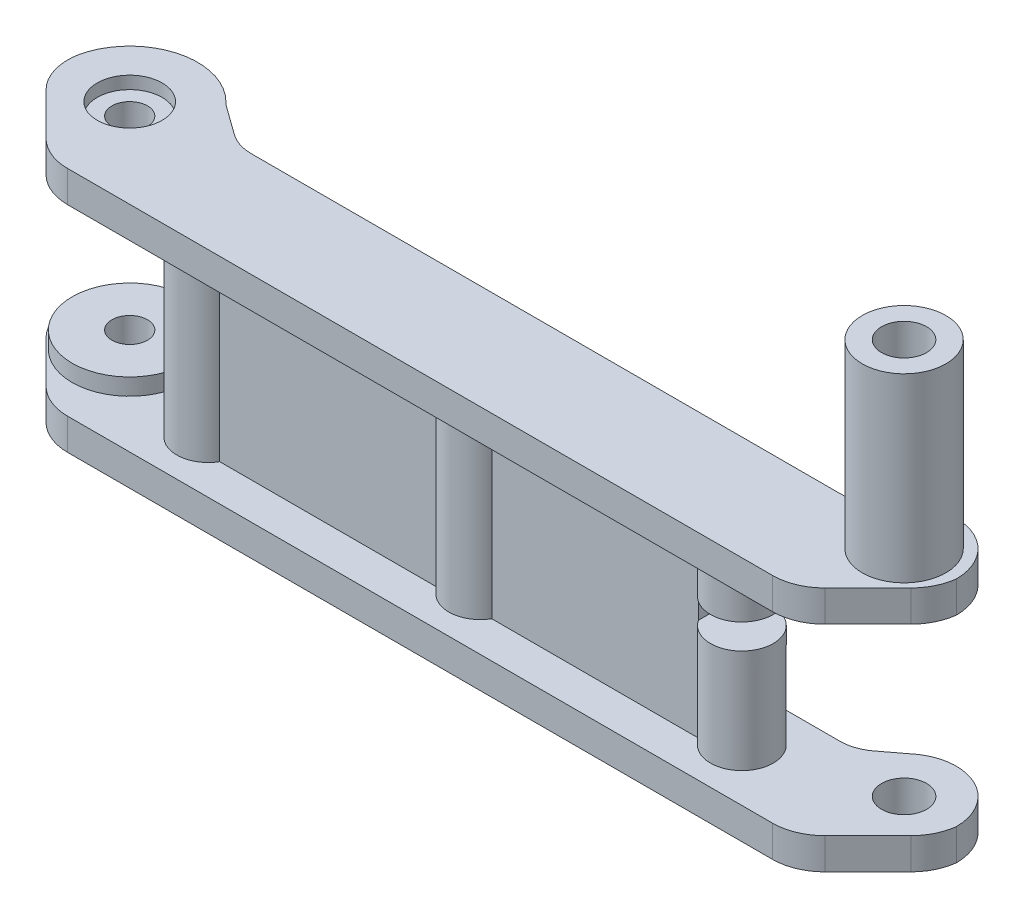
from build123d import *

# Parameters (mm, degrees)
SKETCH_1_R          = 4.5
SKETCH_1_R_2        = 1.6
EXTRUDE_3_DEPTH     = 3
SKETCH_2_R          = 3
EXTRUDE_4_DEPTH     = 17.5
SKETCH_3_R          = 3
SKETCH_3_R_2        = 1.6
EXTRUDE_5_DEPTH     = 3
SKETCH_4_R          = 1.6
SKETCH_4_R_2        = 2.15
CUT_EXTRUDE_1_DEPTH = 100
SKETCH_6_R          = 4
SKETCH_6_R_2        = 2.15
EXTRUDE_6_DEPTH     = 17.3
SKETCH_7_R          = 2.15
SKETCH_7_R_2        = 1.6
EXTRUDE_7_DEPTH     = 3
EXTRUDE_START       = -3
SKETCH_8_R          = 1.6
EXTRUDE_8_DEPTH     = 3
EXTRUDE_10_DEPTH    = 17.5
CUT_EXTRUDE_START   = -100
CUT_EXTRUDE_2_DEPTH = 100
SKETCH_13_R         = 2.15
CUT_EXTRUDE_3_DEPTH = 23.5
CHAMFER_1_SIZE      = 7
FILLET_1_R          = 5
SKETCH_14_W         = 6
SKETCH_14_H         = 2.4
CUT_EXTRUDE_4_DEPTH = 7.5
SKETCH_16_R         = 5.5
EXTRUDE_11_DEPTH    = 1.6
EXTRUDE_START_2     = 1.6
SKETCH_17_R         = 5.5
EXTRUDE_12_DEPTH    = 1.6
CUT_EXTRUDE_START_2 = -50
SKETCH_18_R         = 1.6
CUT_EXTRUDE_5_DEPTH = 50
SKETCH_20_R         = 3.1
CUT_EXTRUDE_7_DEPTH = 1.2
SKETCH_21_R         = 1.7
CUT_EXTRUDE_8_DEPTH = 60
CHAMFER_START       = -1
CHAMFER_2_DEPTH     = 25
CHAMFER_2_2_DEPTH   = 3
CHAMFER_START_2     = 20.5
CHAMFER_2_3_DEPTH   = 3
FILLET_2_R          = 4


with BuildPart() as part:
    # 草图1 → 凸台-拉伸3 (new body)
    # profile 1 of 3: a face of its own
    with BuildSketch(Plane(origin=(0, 0, 0), x_dir=(1, 0, 0), z_dir=(0, 1, 0))):
        with BuildLine():
            Line((-41.5, -6.5), (41.5, -6.5))
            Line((41.5, -6.5), (41.5, 0))
            ThreePointArc((41.5, 0), (37.250387902, -4.493028589), (32.527864045, -0.5))
            Line((32.527864045, -0.5), (-32.527864045, -0.5))
            ThreePointArc((-32.527864045, -0.5), (-37.250387902, -4.493028589), (-41.5, 0))
            Line((-41.5, 0), (-41.5, -6.5))
        make_face()
    # profile 2 of 3: a face of its own
    with BuildSketch(Plane(origin=(0, 0, 0), x_dir=(1, 0, 0), z_dir=(0, 1, 0))):
        with Locations((-37, 0)):
            Circle(SKETCH_1_R)
        with Locations(Location((-37, 0, 0), (0, 0, 270))):
            Circle(SKETCH_1_R_2, mode=Mode.SUBTRACT)
    # profile 3 of 3: a face of its own
    with BuildSketch(Plane(origin=(0, 0, 0), x_dir=(1, 0, 0), z_dir=(0, 1, 0))):
        with Locations((37, 0)):
            Circle(SKETCH_1_R)
        with Locations(Location((37, 0, 0), (0, 0, 270))):
            Circle(SKETCH_1_R_2, mode=Mode.SUBTRACT)
    extrude(amount=EXTRUDE_3_DEPTH)

    # 草图2 → 凸台-拉伸4 (add)
    with BuildSketch(Plane(origin=(0, 3, 0), x_dir=(1, 0, 0), z_dir=(0, 1, 0))):
        with Locations(Location((-26, -3.5, 0), (0, 0, 270))):
            Circle(SKETCH_2_R)
        with Locations(Location((25, -3.5, 0), (0, 0, 270))):
            Circle(SKETCH_2_R)
        with Locations(Location((0, -3.5, 0), (0, 0, 270))):
            Circle(SKETCH_2_R)
    extrude(amount=EXTRUDE_4_DEPTH)

    # 草图3 → 凸台-拉伸5 (add)
    # profile 1 of 7: a face of its own
    with BuildSketch(Plane(origin=(0, 20.5, 0), x_dir=(1, 0, 0), z_dir=(0, 1, 0))):
        with Locations(Location((-26, -3.5, 0), (0, 0, 90))):
            Circle(SKETCH_3_R)
    # profile 2 of 7: a face of its own
    with BuildSketch(Plane(origin=(0, 20.5, 0), x_dir=(1, 0, 0), z_dir=(0, 1, 0))):
        with BuildLine():
            ThreePointArc((0, -6.5), (-3, -3.5), (0, -0.5))
            Line((0, -0.5), (-26, -0.5))
            ThreePointArc((-26, -0.5), (-23.878679656, -1.378679656), (-23, -3.5))
            ThreePointArc((-23, -3.5), (-23.878679656, -5.621320344), (-26, -6.5))
            Line((-26, -6.5), (0, -6.5))
        make_face()
    # profile 3 of 7: a face of its own
    with BuildSketch(Plane(origin=(0, 20.5, 0), x_dir=(1, 0, 0), z_dir=(0, 1, 0))):
        with BuildLine():
            ThreePointArc((3, -3.5), (2.121320344, -1.378679656), (0, -0.5))
            ThreePointArc((0, -0.5), (-3, -3.5), (0, -6.5))
            ThreePointArc((0, -6.5), (2.121320344, -5.621320344), (3, -3.5))
        make_face()
    # profile 4 of 7: a face of its own
    with BuildSketch(Plane(origin=(0, 20.5, 0), x_dir=(1, 0, 0), z_dir=(0, 1, 0))):
        with BuildLine():
            ThreePointArc((25, -6.5), (22, -3.5), (25, -0.5))
            Line((25, -0.5), (0, -0.5))
            ThreePointArc((0, -0.5), (2.121320344, -1.378679656), (3, -3.5))
            ThreePointArc((3, -3.5), (2.121320344, -5.621320344), (0, -6.5))
            Line((0, -6.5), (25, -6.5))
        make_face()
    # profile 5 of 7: a face of its own
    with BuildSketch(Plane(origin=(0, 20.5, 0), x_dir=(1, 0, 0), z_dir=(0, 1, 0))):
        with BuildLine():
            ThreePointArc((28, -3.5), (27.121320344, -1.378679656), (25, -0.5))
            ThreePointArc((25, -0.5), (22, -3.5), (25, -6.5))
            ThreePointArc((25, -6.5), (27.121320344, -5.621320344), (28, -3.5))
        make_face()
    # profile 6 of 7: a face of its own
    with BuildSketch(Plane(origin=(0, 20.5, 0), x_dir=(1, 0, 0), z_dir=(0, 1, 0))):
        with BuildLine():
            Line((41.5, -6.5), (41.5, 0))
            ThreePointArc((41.5, 0), (36.749612098, 4.493028589), (32.527864045, -0.5))
            Line((32.527864045, -0.5), (25, -0.5))
            ThreePointArc((25, -0.5), (28, -3.5), (25, -6.5))
            Line((25, -6.5), (41.5, -6.5))
        make_face()
        with Locations(Location((37, 0, 0), (0, 0, 270))):
            Circle(SKETCH_3_R_2, mode=Mode.SUBTRACT)
    # profile 7 of 7: a face of its own
    with BuildSketch(Plane(origin=(0, 20.5, 0), x_dir=(1, 0, 0), z_dir=(0, 1, 0))):
        with BuildLine():
            ThreePointArc((-26, -0.5), (-29, -3.5), (-26, -6.5))
            Line((-26, -6.5), (-41.5, -6.5))
            Line((-41.5, -6.5), (-41.5, 0))
            ThreePointArc((-41.5, 0), (-36.749612098, 4.493028589), (-32.527864045, -0.5))
            Line((-32.527864045, -0.5), (-26, -0.5))
        make_face()
    extrude(amount=EXTRUDE_5_DEPTH)

    # 草图4 → 切除-拉伸1 (cut)
    with BuildSketch(Plane.XZ):
        with Locations(Location((-37, 0, 0), (0, 0, 90))):
            Circle(SKETCH_4_R)
        with Locations(Location((37, 0, 0), (0, 0, 90))):
            Circle(SKETCH_4_R_2)
    extrude(amount=-CUT_EXTRUDE_1_DEPTH, mode=Mode.SUBTRACT)

    # 草图6 → 凸台-拉伸6 (add)
    with BuildSketch(Plane(origin=(0, 23.5, 0), x_dir=(1, 0, 0), z_dir=(0, 1, 0))):
        with Locations(Location((37, 0, 0), (0, 0, 270))):
            Circle(SKETCH_6_R)
        with Locations(Location((37, 0, 0), (0, 0, 270))):
            Circle(SKETCH_6_R_2, mode=Mode.SUBTRACT)
    extrude(amount=EXTRUDE_6_DEPTH)

    # 草图7 → 凸台-拉伸7 (add)
    with BuildSketch(Plane.XZ):
        with BuildLine():
            Line((43.5, 0), (43.5, 8.5))
            Line((43.5, 8.5), (-43.5, 8.5))
            Line((-43.5, 8.5), (-43.5, 0))
            ThreePointArc((-43.5, 0), (-37.755112713, -6.455989838), (-30.67544468, -1.5))
            Line((-30.67544468, -1.5), (30.67544468, -1.5))
            ThreePointArc((30.67544468, -1.5), (37.755112713, -6.455989838), (43.5, 0))
        make_face()
        with Locations(Location((37, 0, 0), (0, 0, 90))):
            Circle(SKETCH_7_R, mode=Mode.SUBTRACT)
        with Locations(Location((-37, 0, 0), (0, 0, 90))):
            Circle(SKETCH_7_R_2, mode=Mode.SUBTRACT)
    extrude(amount=-EXTRUDE_7_DEPTH)

    # 草图8 → 凸台-拉伸8 (add)
    with BuildSketch(Plane(origin=(0, 23.5, 0), x_dir=(1, 0, 0), z_dir=(0, 1, 0)).offset(EXTRUDE_START)):
        with BuildLine():
            Line((30.67544468, 1.5), (-30.67544468, 1.5))
            ThreePointArc((-30.67544468, 1.5), (-37.755112713, 6.455989838), (-43.5, 0))
            Line((-43.5, 0), (-43.5, -8.5))
            Line((-43.5, -8.5), (43.5, -8.5))
            Line((43.5, -8.5), (43.5, 0))
            ThreePointArc((43.5, 0), (37.755112713, 6.455989838), (30.67544468, 1.5))
        make_face()
        with Locations(Location((-37, 0, 0), (0, 0, 270))):
            Circle(SKETCH_8_R, mode=Mode.SUBTRACT)
        with Locations(Location((37, 0, 0), (0, 0, 270))):
            Circle(SKETCH_8_R, mode=Mode.SUBTRACT)
    extrude(amount=EXTRUDE_8_DEPTH)

    # 草图10 → 凸台-拉伸10 (add)
    with BuildSketch(Plane(origin=(0, 3, 0), x_dir=(1, 0, 0), z_dir=(0, 1, 0))):
        with BuildLine():
            ThreePointArc((22.401923789, -5), (22, -3.5), (22.401923789, -2))
            Line((22.401923789, -2), (2.598076211, -2))
            ThreePointArc((2.598076211, -2), (3, -3.5), (2.598076211, -5))
            Line((2.598076211, -5), (22.401923789, -5))
        make_face()
        with BuildLine():
            ThreePointArc((-2.598076211, -5), (-3, -3.5), (-2.598076211, -2))
            Line((-2.598076211, -2), (-23.401923789, -2))
            ThreePointArc((-23.401923789, -2), (-23, -3.5), (-23.401923789, -5))
            Line((-23.401923789, -5), (-2.598076211, -5))
        make_face()
    extrude(amount=EXTRUDE_10_DEPTH)

    # 草图11 → 切除-拉伸2 (cut)
    with BuildSketch(Plane(origin=(0, 23.5, 0), x_dir=(1, 0, 0), z_dir=(0, 1, 0)).offset(CUT_EXTRUDE_START)):
        with BuildLine():
            ThreePointArc((43.5, 0), (37.755112713, 6.455989838), (30.67544468, 1.5))
            Line((30.67544468, 1.5), (32.230303993, 1.5))
            ThreePointArc((32.230303993, 1.5), (37.758788496, 4.942088629), (42, 0))
            Line((42, 0), (42, -4.153311931))
            ThreePointArc((42, -4.153311931), (43.11350963, -2.207940217), (43.5, 0))
        make_face()
        with BuildLine():
            Line((43.5, -8.5), (43.5, 0))
            ThreePointArc((43.5, 0), (43.11350963, -2.207940217), (42, -4.153311931))
            Line((42, -4.153311931), (42, -8.5))
            Line((42, -8.5), (43.5, -8.5))
        make_face()
    extrude(amount=CUT_EXTRUDE_2_DEPTH, mode=Mode.SUBTRACT)

    # 草图13 → 切除-拉伸3 (cut)
    with BuildSketch(Plane.XZ):
        with Locations(Location((37, 0, 0), (0, 0, 90))):
            Circle(SKETCH_13_R)
    extrude(amount=-CUT_EXTRUDE_3_DEPTH, mode=Mode.SUBTRACT)

    # 倒角1
    chamfer_1_edges = [part.edges().sort_by_distance(p)[0] for p in [
        (-43.5, 1.5, 8.5),
        (-43.5, 22, 8.5),
        (42, 1.5, 8.5),
        (42, 22, 8.5),
    ]]
    chamfer(chamfer_1_edges, length=CHAMFER_1_SIZE)

    # 圆角1
    # the kernel refuses this fillet: 5 mm, written as the material it takes off along each edge
    with BuildSketch(Plane(origin=(42, -5.046401969, 1.5), x_dir=(-0.7071067811865467, 0, 0.7071067811865482), z_dir=(0, 1, 0))) as fillet_1_piece_1:
        with BuildLine():
            CenterArc((2.018560788, -5), FILLET_1_R, 90, 38.013286415)
            Line((-1.060660172, -1.060660172), (-1.122244591, -0.981873375))
            ThreePointArc((-1.122244591, -0.981873375), (-0.601040764, -0.459619408), (-0.070710678, 0.070710678))
            Line((-0.070710678, 0.070710678), (0, 0.1))
            Line((0, 0.1), (2.018560788, 0.1))
            Line((2.018560788, 0.1), (2.018560788, 0))
        make_face()
    extrude(amount=13.092803939, mode=Mode.SUBTRACT)
    with BuildSketch(Plane(origin=(42, 15.453598031, 1.5), x_dir=(0, 0, -1), z_dir=(0, 1, 0))) as fillet_1_piece_2:
        with BuildLine():
            CenterArc((2.108195885, 4.962871927), FILLET_1_R, 225, 38.013286415)
            Line((-1.427338021, 1.427338021), (-1.498048699, 1.356627343))
            Line((-1.498048699, 1.356627343), (-0.070710678, -0.070710678))
            Line((-0.070710678, -0.070710678), (0, -0.1))
            ThreePointArc((0, -0.1), (0.75, -0.1), (1.487836082, -0.099257439))
            Line((1.487836082, -0.099257439), (1.5, 0))
        make_face()
    extrude(amount=13.092803939, mode=Mode.SUBTRACT)
    with BuildSketch(Plane(origin=(35, -5.17766953, 8.5), x_dir=(-1, 0, 0), z_dir=(0, 1, 0)), Plane(origin=(-36.5, -5.17766953, 8.5), x_dir=(-0.707106781186547, 0, -0.7071067811865479), z_dir=(0, 1, 0))) as fillet_1_piece_3:
        with BuildLine():
            CenterArc((FILLET_1_R * 0.414213562373, -FILLET_1_R), FILLET_1_R, 90, 45)
            Line((-FILLET_1_R * 0.292893218813, -FILLET_1_R * 0.292893218813), (-FILLET_1_R * 0.307035354437, -FILLET_1_R * 0.27875108319))
            Line((-FILLET_1_R * 0.307035354437, -FILLET_1_R * 0.27875108319), (-FILLET_1_R * 0.00828427124746, FILLET_1_R * 0.02))
            Line((-FILLET_1_R * 0.00828427124746, FILLET_1_R * 0.02), (FILLET_1_R * 0.414213562373, FILLET_1_R * 0.02))
            Line((FILLET_1_R * 0.414213562373, FILLET_1_R * 0.02), (FILLET_1_R * 0.414213562373, 0))
        make_face()
    extrude(amount=13.355339059, mode=Mode.SUBTRACT)
    with BuildSketch(Plane(origin=(35, 15.32233047, 8.5), x_dir=(0.7071067811865476, 0, -0.7071067811865476), z_dir=(0, 1, 0)), Plane(origin=(-36.5, 15.32233047, 8.5), x_dir=(1, 0, 0), z_dir=(0, 1, 0))) as fillet_1_piece_4:
        with BuildLine():
            CenterArc((FILLET_1_R * 0.414213562373, FILLET_1_R), FILLET_1_R, 225, 45)
            Line((-FILLET_1_R * 0.292893218813, FILLET_1_R * 0.292893218813), (-FILLET_1_R * 0.307035354437, FILLET_1_R * 0.27875108319))
            Line((-FILLET_1_R * 0.307035354437, FILLET_1_R * 0.27875108319), (-FILLET_1_R * 0.00828427124746, -FILLET_1_R * 0.02))
            Line((-FILLET_1_R * 0.00828427124746, -FILLET_1_R * 0.02), (FILLET_1_R * 0.414213562373, -FILLET_1_R * 0.02))
            Line((FILLET_1_R * 0.414213562373, -FILLET_1_R * 0.02), (FILLET_1_R * 0.414213562373, 0))
        make_face()
    extrude(amount=13.355339059, mode=Mode.SUBTRACT)
    with BuildSketch(Plane(origin=(-43.5, -9.091963291, 1.5), x_dir=(0.09767763487953848, 0, -0.9952181065697808), z_dir=(0, 1, 0))) as fillet_1_piece_5:
        with BuildLine():
            CenterArc((2.475974909, -4.86338557), FILLET_1_R, 76.575603984, 64.029849994)
            Line((-1.387995041, -1.6901008), (-1.774392036, -1.372772323))
            Line((-1.774392036, -1.372772323), (-0.386396995, 0.317328477))
            Line((-0.386396995, 0.317328477), (-0.048838817, 0.497609053))
            ThreePointArc((-0.048838817, 0.497609053), (1.443988342, 0.644125506), (3.752866357, 0.486338557))
            Line((3.752866357, 0.486338557), (3.636785316, 0))
        make_face()
    extrude(amount=21.183926582, mode=Mode.SUBTRACT)
    with BuildSketch(Plane(origin=(-43.5, 11.408036709, 1.5), x_dir=(0.7071067811865467, 0, 0.7071067811865483), z_dir=(0, 1, 0))) as fillet_1_piece_6:
        with BuildLine():
            CenterArc((2.187000445, 5), FILLET_1_R, 205.970150006, 64.029849994)
            Line((-2.308111091, 2.810485835), (-2.757622245, 2.591534419))
            ThreePointArc((-2.757622245, 2.591534419), (-1.414213562, 0.707106781), (-0.353553391, -0.353553391))
            Line((-0.353553391, -0.353553391), (0, -0.5))
            Line((0, -0.5), (2.187000445, -0.5))
            Line((2.187000445, -0.5), (2.187000445, 0))
        make_face()
    extrude(amount=21.183926582, mode=Mode.SUBTRACT)

    # 草图14 → 切除-拉伸4 (cut)
    with BuildSketch(Plane(origin=(30, 0, 0), x_dir=(0, 0, -1), z_dir=(1, 0, 0))):
        with Locations((-3.5, 14.1)):
            Rectangle(SKETCH_14_W, SKETCH_14_H)
    extrude(amount=-CUT_EXTRUDE_4_DEPTH, mode=Mode.SUBTRACT)

    # 草图16 → 凸台-拉伸11 (add)
    with BuildSketch(Plane.XZ.offset(-20.5)):
        with Locations(Location((-37, 0, 0), (0, 0, 90))):
            Circle(SKETCH_16_R)
    extrude(amount=EXTRUDE_11_DEPTH)

    # 草图17 → 凸台-拉伸12 (add)
    with BuildSketch(Plane(origin=(0, 3, 0), x_dir=(1, 0, 0), z_dir=(0, 1, 0)).offset(EXTRUDE_START_2)):
        with Locations(Location((-37, 0, 0), (0, 0, 270))):
            Circle(SKETCH_17_R)
    extrude(amount=-EXTRUDE_12_DEPTH)

    # 草图18 → 切除-拉伸5 (cut)
    with BuildSketch(Plane(origin=(0, 20.5, 0), x_dir=(1, 0, 0), z_dir=(0, 1, 0)).offset(CUT_EXTRUDE_START_2)):
        with Locations(Location((-37, 0, 0), (0, 0, 270))):
            Circle(SKETCH_18_R)
    extrude(amount=CUT_EXTRUDE_5_DEPTH, mode=Mode.SUBTRACT)

    # 草图20 → 切除-拉伸7 (cut)
    with BuildSketch(Plane(origin=(0, 23.5, 0), x_dir=(1, 0, 0), z_dir=(0, 1, 0))):
        with Locations(Location((-37, 0, 0), (0, 0, 270))):
            Circle(SKETCH_20_R)
    extrude(amount=-CUT_EXTRUDE_7_DEPTH, mode=Mode.SUBTRACT)

    # 草图21 → 切除-拉伸8 (cut)
    with BuildSketch(Plane(origin=(0, 22.3, 0), x_dir=(1, 0, 0), z_dir=(0, 1, 0))):
        with Locations(Location((-37, 0, 0), (0, 0, 270))):
            Circle(SKETCH_21_R)
    extrude(amount=-CUT_EXTRUDE_8_DEPTH, mode=Mode.SUBTRACT)

    # 倒角2: read off the stored shape, not the designer's step
    # 倒角2 outline → 倒角2 (cut)
    with BuildSketch(Plane(origin=(0, 0, 0), x_dir=(1, 0, 0), z_dir=(0, 1, 0)).offset(CHAMFER_START)):
        with BuildLine():
            ThreePointArc((34.173499565, 4.124426662), (33.977148592, 3.982759014), (33.787886016, 3.831752047))
            Line((33.787886016, 3.831752047), (34.173499565, 4.124426662))
        make_face()
    extrude(amount=CHAMFER_2_DEPTH, mode=Mode.SUBTRACT)

    # Chamfer 2 2 outline → Chamfer 2 2 (add)
    with BuildSketch(Plane(origin=(0, 0, 0), x_dir=(1, 0, 0), z_dir=(0, 1, 0))):
        with BuildLine():
            Line((-30.67544468, 1.5), (-28.19352122, 1.5))
            Line((-28.19352122, 1.5), (-32.185327475, 4.366798424))
            ThreePointArc((-32.185327475, 4.366798424), (-31.248892929, 3.028987859), (-30.67544468, 1.5))
        make_face()
        with BuildLine():
            Line((33.787886016, 3.831752047), (30.715685226, 1.5))
            Line((30.715685226, 1.5), (32.230303993, 1.5))
            ThreePointArc((32.230303993, 1.5), (32.842285533, 2.777302723), (33.787886016, 3.831752047))
        make_face()
    extrude(amount=CHAMFER_2_2_DEPTH)

    # Chamfer 2 3 outline → Chamfer 2 3 (add)
    with BuildSketch(Plane(origin=(0, 0, 0), x_dir=(1, 0, 0), z_dir=(0, 1, 0)).offset(CHAMFER_START_2)):
        with BuildLine():
            Line((33.787886016, 3.831752047), (30.715685226, 1.5))
            Line((30.715685226, 1.5), (32.230303993, 1.5))
            ThreePointArc((32.230303993, 1.5), (32.842285533, 2.777302723), (33.787886016, 3.831752047))
        make_face()
    extrude(amount=CHAMFER_2_3_DEPTH)

    # 倒角3
    # the kernel refuses this chamfer: 5.389097704, 4 mm, written as the material it adds along each edge
    with BuildSketch(Plane(origin=(-30.67544468, 20.5, -1.5), x_dir=(-0.4659981321381575, 0, -0.8847857033450237), z_dir=(0, 1, 0))) as chamfer_3_piece_1:
        with BuildLine():
            Line((3.432952569, 0.096320014), (-1.349419443, -2.292290407))
            Line((-1.349419443, -2.292290407), (-1.444783375, -2.242064218))
            ThreePointArc((-1.444783375, -2.242064218), (-0.714445414, -1.125217245), (-0.095363932, 0.050226189))
            Line((-0.095363932, 0.050226189), (0.026863448, 0.104380577))
            ThreePointArc((0.026863448, 0.104380577), (1.718710533, -0.096583325), (3.40608912, 0.20070059))
            Line((3.40608912, 0.20070059), (3.432952569, 0.096320014))
        make_face()
    extrude(amount=3)

    # 圆角2
    # the kernel refuses this fillet: 4 mm, written as the material it adds along each edge
    with BuildSketch(Plane(origin=(30.715685226, 20.5, -1.5), x_dir=(-1, 0, 0), z_dir=(0, 1, 0))) as fillet_2_piece_1:
        with BuildLine():
            CenterArc((FILLET_2_R * 0.336517032608, -FILLET_2_R), FILLET_2_R, 90, 37.197926003)
            Line((-FILLET_2_R * 0.268053249006, -FILLET_2_R * 0.203448197172), (0, 0))
            Line((0, 0), (FILLET_2_R * 0.336517032608, 0))
        make_face()
    extrude(amount=3)
    with BuildSketch(Plane(origin=(-28.19352122, 0, -1.5), x_dir=(1, 0, 0), z_dir=(0, 1, 0))) as fillet_2_piece_2:
        with BuildLine():
            CenterArc((FILLET_2_R * 0.32188138429, FILLET_2_R), FILLET_2_R, 234.315198771, 35.684801229)
            Line((-FILLET_2_R * 0.261444386278, FILLET_2_R * 0.187761706522), (0, 0))
            Line((0, 0), (FILLET_2_R * 0.32188138429, 0))
        make_face()
    extrude(amount=3)
    with BuildSketch(Plane(origin=(30.715685226, 0, -1.5), x_dir=(0.7965518028281459, 0, -0.6045702816143302), z_dir=(0, 1, 0))) as fillet_2_piece_3:
        with BuildLine():
            CenterArc((FILLET_2_R * 0.336517032608, FILLET_2_R), FILLET_2_R, 232.802073997, 37.197926003)
            Line((-FILLET_2_R * 0.268053249006, FILLET_2_R * 0.203448197172), (0, 0))
            Line((0, 0), (FILLET_2_R * 0.336517032608, 0))
        make_face()
    extrude(amount=3)
    with BuildSketch(Plane(origin=(-32.185327475, 0, -4.366798424), x_dir=(0.8122382934777724, 0, 0.5833257705676271), z_dir=(0, 1, 0))) as fillet_2_piece_4:
        with BuildLine():
            CenterArc((0.37315848, 4), FILLET_2_R, 260.480336743, 9.519663257)
            ThreePointArc((-0.288385832, 0.055084396), (-0.143881862, 0.029170674), (0, 0))
            Line((0, 0), (0.37315848, 0))
        make_face()
    extrude(amount=3)
    with BuildSketch(Plane(origin=(-28.19352122, 23.5, -1.5), x_dir=(1, 0, 0), z_dir=(0, -1, 0))) as fillet_2_piece_5:
        with BuildLine():
            CenterArc((FILLET_2_R * 0.3218813843, -FILLET_2_R), FILLET_2_R, 90, 35.68480123)
            Line((-FILLET_2_R * 0.261444386283, -FILLET_2_R * 0.187761706533), (0, 0))
            Line((0, 0), (FILLET_2_R * 0.3218813843, 0))
        make_face()
    extrude(amount=3)
    with BuildSketch(Plane(origin=(-32.185327475, 23.5, -4.366798424), x_dir=(-0.688372609239569, 0, -0.7253572573902514), z_dir=(0, -1, 0))) as fillet_2_piece_6:
        with BuildLine():
            CenterArc((0.383937836, 3.998979744), FILLET_2_R, 259.186225678, 9.519663257)
            Line((-0.366531997, 0.070011045), (0, 0))
            ThreePointArc((0, 0), (0.146799761, 0.001657917), (0.293599522, 0))
        make_face()
    extrude(amount=3)
    # the kernel refuses this fillet: 4 mm, written as the material it takes off along each edge
    with BuildSketch(Plane(origin=(34.173499565, 19.751308545, -4.124426662), x_dir=(-0.7965518024446779, 0, 0.6045702821195685), z_dir=(0, 1, 0)), Plane(origin=(34.173499565, -0.748691455, -4.124426662), x_dir=(-0.7965518024446777, 0, 0.6045702821195689), z_dir=(0, 1, 0))) as fillet_2_2_piece_1:
        with BuildLine():
            CenterArc((0.133929997, 4), FILLET_2_R, 263.792944423, 6.207055577)
            ThreePointArc((-0.298557114, 0.023449372), (-0.14945416, 0.009488913), (0, 0))
            Line((0, 0), (0.133929997, 0))
        make_face()
    extrude(amount=4.497382911, mode=Mode.SUBTRACT)


solid = part.part
